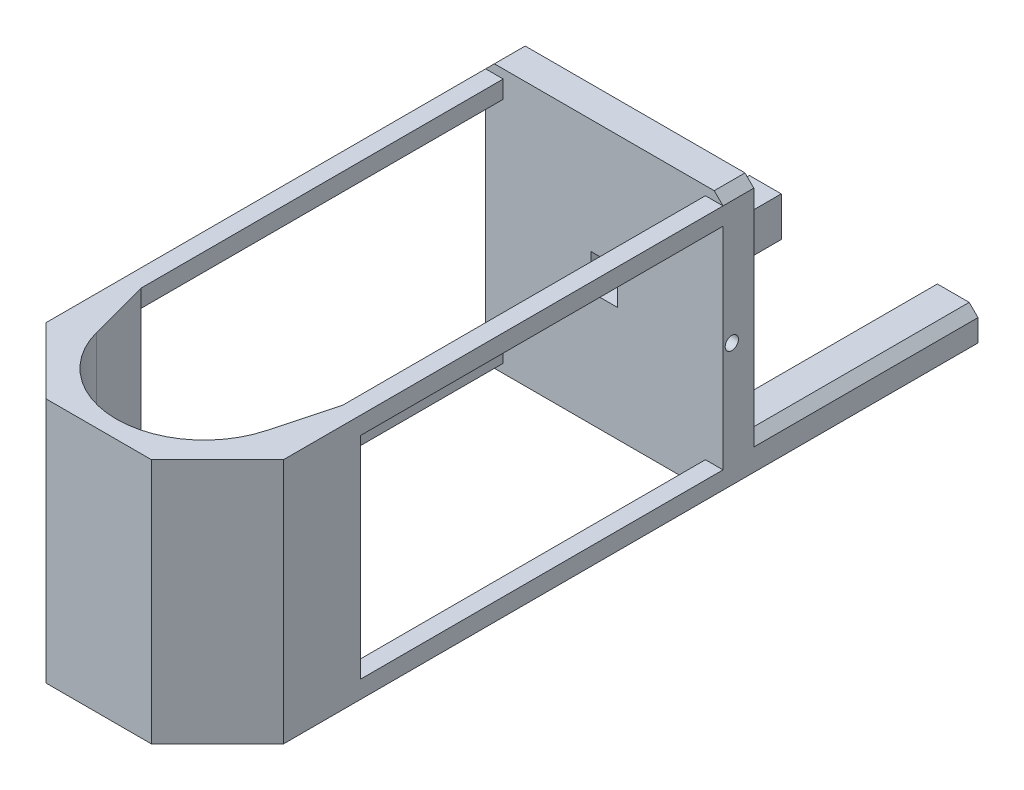
from build123d import *

# Parameters (mm, degrees)
BOSS_EXTRUDE1_DEPTH      = 5
BOSS_EXTRUDE2_DEPTH      = 56
BOSS_EXTRUDE2_2_DEPTH    = 56
BOSS_EXTRUDE3_DEPTH      = 2
BOSS_EXTRUDE3_DEPTH_BACK = 5
SKETCH9_W                = 6
SKETCH9_H                = 8
CUT_EXTRUDE3_DEPTH       = 6
CUT_EXTRUDE4_DEPTH       = 85.267431431
CUT_EXTRUDE4_DEPTH_BACK  = 85.267431431
SKETCH10_R               = 1.5
BOSS_EXTRUDE4_DEPTH      = 28
BOSS_EXTRUDE4_DEPTH_BACK = 28
SKETCH11_W               = 54
SKETCH11_H               = 115
CUT_EXTRUDE5_DEPTH       = 146.478520751
CUT_EXTRUDE6_DEPTH       = 139.610966377
CUT_EXTRUDE6_DEPTH_BACK  = 139.610966377
SKETCH13_W               = 82.436897529
SKETCH13_H               = 48
CHAMFER1_SIZE            = 15
CHAMFER2_SIZE            = 15


with BuildPart() as part:
    # Sketch1 → Boss-Extrude1 (new body)
    with BuildSketch(Plane.XY):
        Polygon((37.6, 51), (52, 51), (54, 53), (54, 58), (52, 60), (2, 60), (0, 58), (0, 53), (2, 51), (16.4, 51), align=None)
    extrude(amount=BOSS_EXTRUDE1_DEPTH)



with BuildPart() as body_2:
    # Sketch2 → Boss-Extrude2 (new body)
    with BuildSketch(Plane.XY.offset(-51)):
        Polygon((0, 7), (0, 2), (2, 0), (9.25, 0), (9.25, 9), (2, 9), align=None)
    extrude(amount=BOSS_EXTRUDE2_DEPTH)


with BuildPart() as body_3:
    # Sketch2 → Boss-Extrude2 2 (new body)
    with BuildSketch(Plane.XY.offset(-51)):
        Polygon((54, 2), (54, 7), (52, 9), (44.75, 9), (44.75, 0), (52, 0), align=None)
    extrude(amount=BOSS_EXTRUDE2_2_DEPTH)


with BuildPart() as part_1:
    add(part.part)

    add(body_2.part)  # Boss-Extrude3 merges body 2

    add(body_3.part)  # Boss-Extrude3 merges body 3
    # Sketch8 → Boss-Extrude3 (add, two sides: drawn at the far end of the back side and taken through both)
    with BuildSketch(Plane.XY.offset(5).offset(-BOSS_EXTRUDE3_DEPTH_BACK)):
        Polygon((0, 2), (0, 58), (2, 60), (52, 60), (54, 58), (54, 2), (52, 0), (2, 0), align=None)
    extrude(amount=BOSS_EXTRUDE3_DEPTH + BOSS_EXTRUDE3_DEPTH_BACK)

    # Sketch9 → Cut-Extrude3 (cut)
    with BuildSketch(Plane.XY.offset(7)):
        with Locations((27, 30)):
            Rectangle(SKETCH9_W, SKETCH9_H)
    extrude(amount=-CUT_EXTRUDE3_DEPTH, mode=Mode.SUBTRACT)

    # Sketch10 → Cut-Extrude4 (cut, two sides: drawn at the far end of the back side and taken through both)
    with BuildSketch(Plane.ZY.offset(-30).offset(-CUT_EXTRUDE4_DEPTH_BACK)):
        with Locations((5, 30)):
            Circle(SKETCH10_R)
    extrude(amount=CUT_EXTRUDE4_DEPTH + CUT_EXTRUDE4_DEPTH_BACK, mode=Mode.SUBTRACT)

    # Sketch11 → Boss-Extrude4 (add, two sides: drawn at the far end of the back side and taken through both)
    with BuildSketch(Plane(origin=(0, 30, 0), x_dir=(1, 0, 0), z_dir=(0, 1, 0)).offset(-BOSS_EXTRUDE4_DEPTH_BACK)):
        with Locations((27, -64.5)):
            Rectangle(SKETCH11_W, SKETCH11_H)
    extrude(amount=BOSS_EXTRUDE4_DEPTH + BOSS_EXTRUDE4_DEPTH_BACK)

    # Sketch12 → Cut-Extrude5 (cut, through all)
    with BuildSketch(Plane(origin=(0, 58, 0), x_dir=(1, 0, 0), z_dir=(0, 1, 0))):
        with BuildLine():
            Line((4, -89.436897529), (4, -7))
            Line((4, -7), (50, -7))
            Line((50, -7), (50, -89.436897529))
            Line((50, -89.436897529), (46.318516526, -103.176380902))
            ThreePointArc((46.318516526, -103.176380902), (27, -118), (7.681483474, -103.176380902))
            Line((7.681483474, -103.176380902), (4, -89.436897529))
        make_face()
    extrude(amount=-CUT_EXTRUDE5_DEPTH, mode=Mode.SUBTRACT)

    # Sketch13 → Cut-Extrude6 (cut, two sides: drawn at the far end of the back side and taken through both)
    with BuildSketch(Plane(origin=(27, 0, 0), x_dir=(0, 0, -1), z_dir=(1, 0, 0)).offset(-CUT_EXTRUDE6_DEPTH_BACK)):
        with Locations((-48.218448765, 30)):
            Rectangle(SKETCH13_W, SKETCH13_H)
    extrude(amount=CUT_EXTRUDE6_DEPTH + CUT_EXTRUDE6_DEPTH_BACK, mode=Mode.SUBTRACT)

    # Chamfer1
    chamfer1_edges = [part_1.edges().sort_by_distance(p)[0] for p in [
        (0, 30, 122),
    ]]
    chamfer(chamfer1_edges, length=CHAMFER1_SIZE)

    # Chamfer2
    chamfer2_edges = [part_1.edges().sort_by_distance(p)[0] for p in [
        (54, 30, 122),
    ]]
    chamfer(chamfer2_edges, length=CHAMFER2_SIZE)


solid = part_1.part
